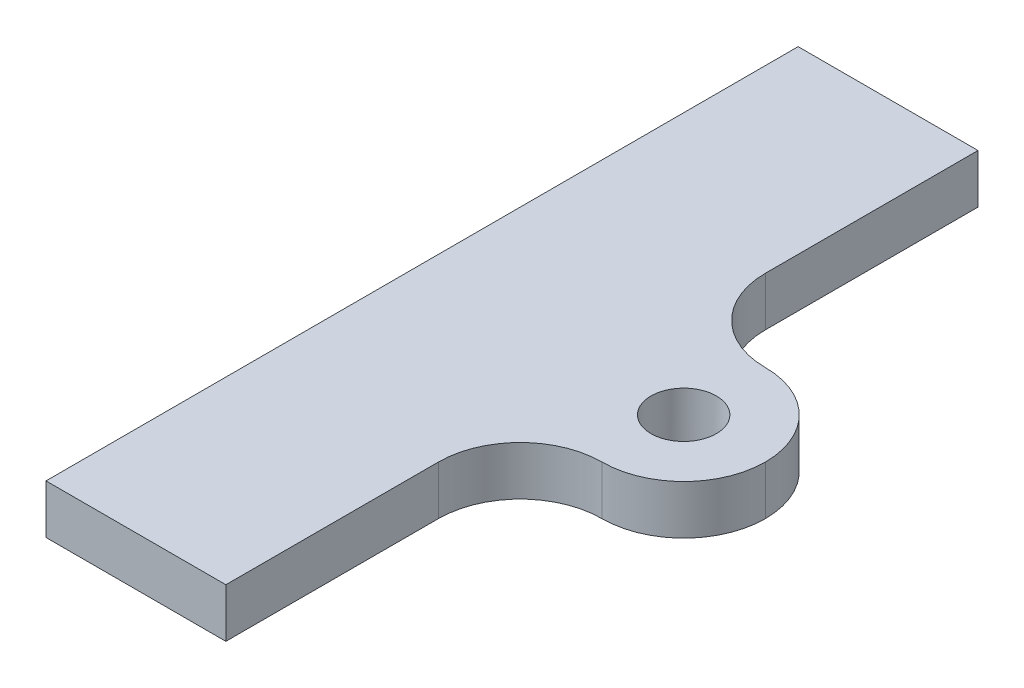
from build123d import *

# Parameters (mm, degrees)
SKETCH1_W           = 9
SKETCH1_H           = 46
BOSS_EXTRUDE1_DEPTH = 3
SKETCH2_R           = 1.25
BOSS_EXTRUDE2_DEPTH = 5
SKETCH3_W           = 46
SKETCH3_H           = 3
BOSS_EXTRUDE3_DEPTH = 2
SKETCH4_W           = 10
SKETCH4_H           = 3
BOSS_EXTRUDE4_DEPTH = 10
SKETCH5_R           = 2
CUT_EXTRUDE1_DEPTH  = 10
FILLET1_R           = 5
FILLET2_R           = 5


with BuildPart() as part:
    # Sketch1 → Boss-Extrude1 (new body)
    with BuildSketch(Plane(origin=(0, 0, 0), x_dir=(1, 0, 0), z_dir=(0, 1, 0))):
        Rectangle(SKETCH1_W, SKETCH1_H)
    extrude(amount=BOSS_EXTRUDE1_DEPTH)

    # Sketch2 → Boss-Extrude2 (add)
    with BuildSketch(Plane(origin=(0, 3, 0), x_dir=(1, 0, 0), z_dir=(0, 1, 0))):
        with Locations(Location((-1.7, -9, 0), (0, 0, 270))):
            Circle(SKETCH2_R)
        with Locations(Location((-1.7, 6, 0), (0, 0, 270))):
            Circle(SKETCH2_R)
    extrude(amount=-BOSS_EXTRUDE2_DEPTH)

    # Sketch3 → Boss-Extrude3 (add)
    with BuildSketch(Plane(origin=(4.5, 0, 0), x_dir=(0, 0, -1), z_dir=(1, 0, 0))):
        with Locations((0, 1.5)):
            Rectangle(SKETCH3_W, SKETCH3_H)
    extrude(amount=BOSS_EXTRUDE3_DEPTH)

    # Sketch4 → Boss-Extrude4 (add)
    with BuildSketch(Plane(origin=(6.5, 0, 0), x_dir=(0, 0, -1), z_dir=(1, 0, 0))):
        with Locations((0, 1.5)):
            Rectangle(SKETCH4_W, SKETCH4_H)
    extrude(amount=BOSS_EXTRUDE4_DEPTH)

    # Sketch5 → Cut-Extrude1 (cut)
    with BuildSketch(Plane(origin=(0, 3, 0), x_dir=(1, 0, 0), z_dir=(0, 1, 0))):
        with Locations(Location((11.5, 0, 0), (0, 0, 270))):
            Circle(SKETCH5_R)
    extrude(amount=-CUT_EXTRUDE1_DEPTH, mode=Mode.SUBTRACT)

    # Fillet1
    fillet1_edges = [part.edges().sort_by_distance(p)[0] for p in [
        (16.5, 1.5, 5),
        (16.5, 1.5, -5),
    ]]
    fillet(fillet1_edges, radius=FILLET1_R - 0.0001)  # a hair under: the kernel refuses the full size

    # Fillet2
    fillet2_edges = [part.edges().sort_by_distance(p)[0] for p in [
        (6.5, 1.5, -5),
        (6.5, 1.5, 5),
    ]]
    fillet(fillet2_edges, radius=FILLET2_R)


solid = part.part
